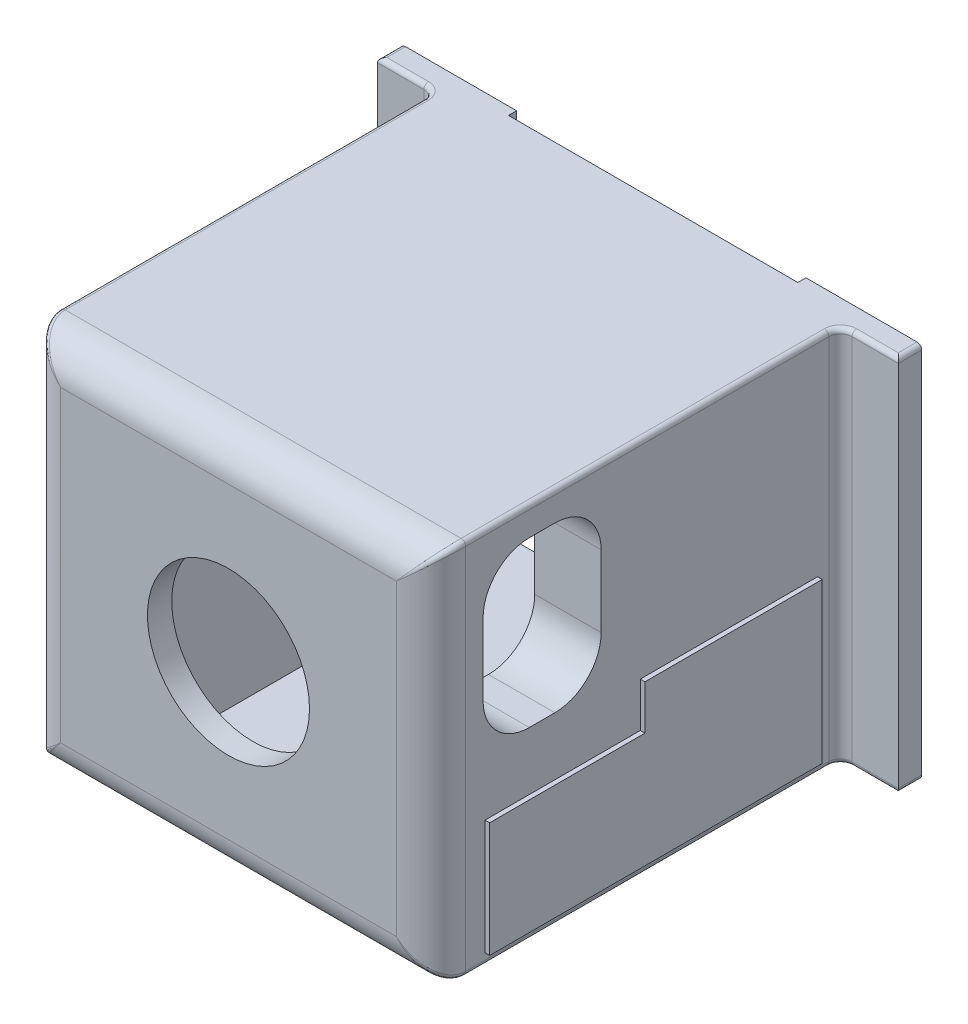
from build123d import *

# Parameters (mm, degrees)
BOSS_EXTRUDE1_DEPTH = 163
SKETCH3_W           = 117.653625048
SKETCH3_H           = 152.57018474
CUT_EXTRUDE2_DEPTH  = 173
CUT_EXTRUDE3_DEPTH  = 113
SKETCH4_R           = 35
CUT_EXTRUDE4_DEPTH  = 113
BOSS_EXTRUDE2_DEPTH = 2
SKETCH7_R           = 2.5
BOSS_EXTRUDE3_DEPTH = 10
FILLET1_R           = 5
FILLET2_R           = 15
FILLET4_R           = 2


with BuildPart() as part:
    # Sketch1 → Boss-Extrude1 (new body)
    with BuildSketch(Plane(origin=(0, 0, 0), x_dir=(1, 0, 0), z_dir=(0, 1, 0))):
        Polygon((-87.5, -71.899388966), (87.5, -71.899388966), (87.5, 105.000611034), (112.5, 105.000611034), (112.5, 115.100611034), (62.5, 115.100611034), (62.5, 111.600611034), (-62.5, 111.600611034), (-62.5, 115.100611034), (-112.5, 115.100611034), (-112.5, 105.000611034), (-87.5, 105.000611034), align=None)
    extrude(amount=BOSS_EXTRUDE1_DEPTH)

    # Sketch3 → Cut-Extrude2 (cut)
    with BuildSketch(Plane(origin=(0, 0, -111.600611034), x_dir=(-1, 0, 0), z_dir=(0, 0, -1))):
        with Locations((0, 81.5)):
            Rectangle(SKETCH3_W, SKETCH3_H)
    extrude(amount=-CUT_EXTRUDE2_DEPTH, mode=Mode.SUBTRACT)

    # Sketch2 → Cut-Extrude3 (cut)
    with BuildSketch(Plane(origin=(87.5, 0, 0), x_dir=(0, 0, -1), z_dir=(1, 0, 0))):
        with BuildLine():
            Line((-18.399388966, 79.5), (-29.399388966, 79.5))
            ThreePointArc((-29.399388966, 79.5), (-43.54152459, 85.357864376), (-49.399388966, 99.5))
            Line((-49.399388966, 99.5), (-49.399388966, 130.5))
            ThreePointArc((-49.399388966, 130.5), (-43.54152459, 144.642135624), (-29.399388966, 150.5))
            Line((-29.399388966, 150.5), (-18.399388966, 150.5))
            ThreePointArc((-18.399388966, 150.5), (-4.257253343, 144.642135624), (1.600611034, 130.5))
            Line((1.600611034, 130.5), (1.600611034, 99.5))
            ThreePointArc((1.600611034, 99.5), (-4.257253343, 85.357864376), (-18.399388966, 79.5))
        make_face()
    extrude(amount=-CUT_EXTRUDE3_DEPTH, mode=Mode.SUBTRACT)

    # Sketch4 → Cut-Extrude4 (cut)
    with BuildSketch(Plane.XY.offset(71.899388966)):
        with Locations((0, 81.5)):
            Circle(SKETCH4_R)
    extrude(amount=-CUT_EXTRUDE4_DEPTH, mode=Mode.SUBTRACT)



with BuildPart() as body_2:
    # Sketch6 → Boss-Extrude2 (new body)
    with BuildSketch(Plane(origin=(89.5, 0, 0), x_dir=(0, 0, -1), z_dir=(1, 0, 0))):
        Polygon((-50.533204725, 6.743576244), (93.108719456, 6.743576244), (93.108719456, 75.629076668), (16.550611034, 75.629076668), (16.550611034, 56.410081339), (-50.533204725, 56.410081339), align=None)
    extrude(amount=BOSS_EXTRUDE2_DEPTH)


with BuildPart() as part_1:
    add(part.part)

    add(body_2.part)  # Boss-Extrude3 merges body 2
    # Sketch7 → Boss-Extrude3 (add)
    with BuildSketch(Plane(origin=(91.5, 0, 0), x_dir=(0, 0, -1), z_dir=(1, 0, 0))):
        with Locations((-41.807901093, 11.837692269)):
            Circle(SKETCH7_R)
        with Locations((-41.807901093, 51.473587284)):
            Circle(SKETCH7_R)
        with Locations((83.570950486, 11.837692269)):
            Circle(SKETCH7_R)
        with Locations((83.570950486, 70.078191066)):
            Circle(SKETCH7_R)
    extrude(amount=-BOSS_EXTRUDE3_DEPTH)

    # Fillet1
    fillet1_edges = [part_1.edges().sort_by_distance(p)[0] for p in [
        (-87.5, 81.5, -105.000611034),
        (87.5, 81.5, -105.000611034),
    ]]
    fillet(fillet1_edges, radius=FILLET1_R)

    # Fillet2
    fillet2_edges = [part_1.edges().sort_by_distance(p)[0] for p in [
        (0, 0, 71.899388966),
        (-87.5, 81.5, 71.899388966),
        (0, 163, 71.899388966),
        (87.5, 81.5, 71.899388966),
    ]]
    fillet(fillet2_edges, radius=FILLET2_R)

    # Fillet4
    fillet4_edges = [part_1.edges().sort_by_distance(p)[0] for p in [
        (82.190733611, 157.690733611, 68.348829218),
        (87.5, 163, -21.550611034),
        (88.964466094, 163, -103.536144939),
        (82.190733611, 5.309266389, 68.348829218),
        (87.5, 0, -21.550611034),
        (88.964466094, 0, -103.536144939),
        (-82.190733611, 157.690733611, 68.348829218),
        (-87.5, 163, -21.550611034),
        (-88.964466094, 163, -103.536144939),
        (-82.190733611, 5.309266389, 68.348829218),
        (-87.5, 0, -21.550611034),
        (-88.964466094, 0, -103.536144939),
        (112.5, 163, -110.050611034),
        (102.5, 163, -105.000611034),
        (102.5, 0, -105.000611034),
        (112.5, 0, -110.050611034),
        (-112.5, 163, -110.050611034),
        (-102.5, 163, -105.000611034),
        (-102.5, 0, -105.000611034),
        (-112.5, 0, -110.050611034),
    ]]
    fillet(fillet4_edges, radius=FILLET4_R)


solid = part_1.part
